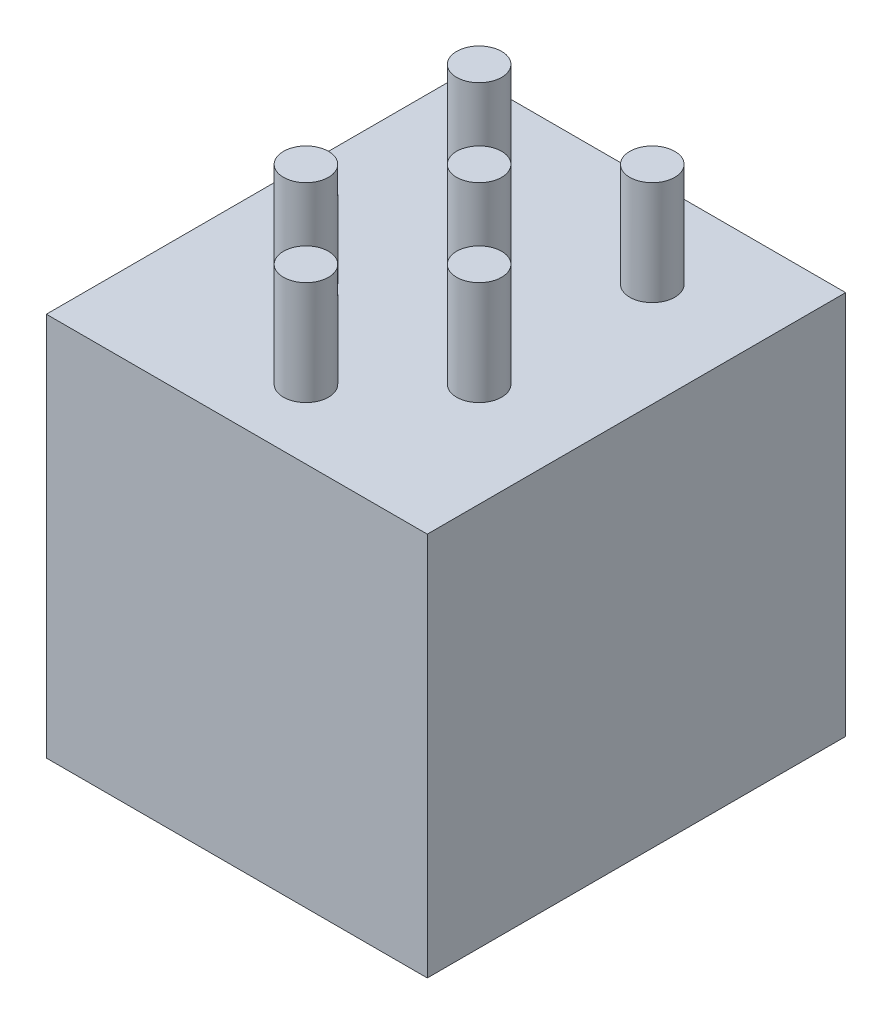
from build123d import *

# Parameters (mm, degrees)
SKETCH1_W           = 11
SKETCH1_H           = 12.08
BOSS_EXTRUDE1_DEPTH = 11.1
SKETCH3_R           = 0.65
BOSS_EXTRUDE2_DEPTH = 3


with BuildPart() as part:
    # Sketch1 → Boss-Extrude1 (new body)
    with BuildSketch(Plane(origin=(0, 0, 0), x_dir=(1, 0, 0), z_dir=(0, 1, 0))):
        Rectangle(SKETCH1_W, SKETCH1_H)
    extrude(amount=BOSS_EXTRUDE1_DEPTH)

    # Sketch3 → Boss-Extrude2 (add)
    with BuildSketch(Plane(origin=(0, 11.1, 0), x_dir=(1, 0, 0), z_dir=(0, 1, 0))):
        with Locations((0, -4.043588141)):
            Circle(SKETCH3_R)
        with Locations((2.5, -1.543588141)):
            Circle(SKETCH3_R)
        with Locations((-2.5, -1.543588141)):
            Circle(SKETCH3_R)
        with Locations((-2.5, 3.456411859)):
            Circle(SKETCH3_R)
        with Locations((2.5, 3.456411859)):
            Circle(SKETCH3_R)
        with Locations((0, 0.956411859)):
            Circle(SKETCH3_R)
    extrude(amount=BOSS_EXTRUDE2_DEPTH)


solid = part.part
